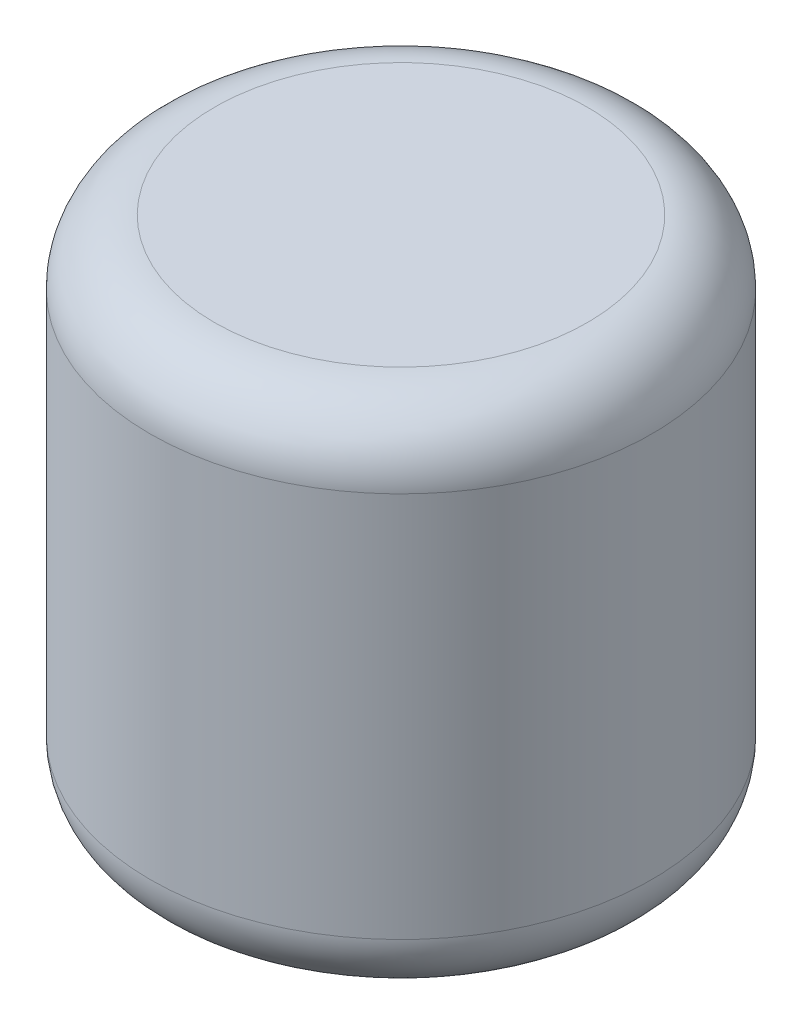
from build123d import *

# Parameters (mm, degrees)
SKETCH1_R           = 49.53
BOSS_EXTRUDE1_DEPTH = 101.6
FILLET1_R           = 12.7


with BuildPart() as part:
    # Sketch1 → Boss-Extrude1 (new body)
    with BuildSketch(Plane(origin=(0, 0, 0), x_dir=(1, 0, 0), z_dir=(0, 1, 0))):
        Circle(SKETCH1_R)
    extrude(amount=BOSS_EXTRUDE1_DEPTH)

    # Fillet1
    fillet1_edges = [part.edges().sort_by_distance(p)[0] for p in [
        (-49.53, 0, 0),
        (-49.53, 101.6, 0),
    ]]
    fillet(fillet1_edges, radius=FILLET1_R)


solid = part.part
